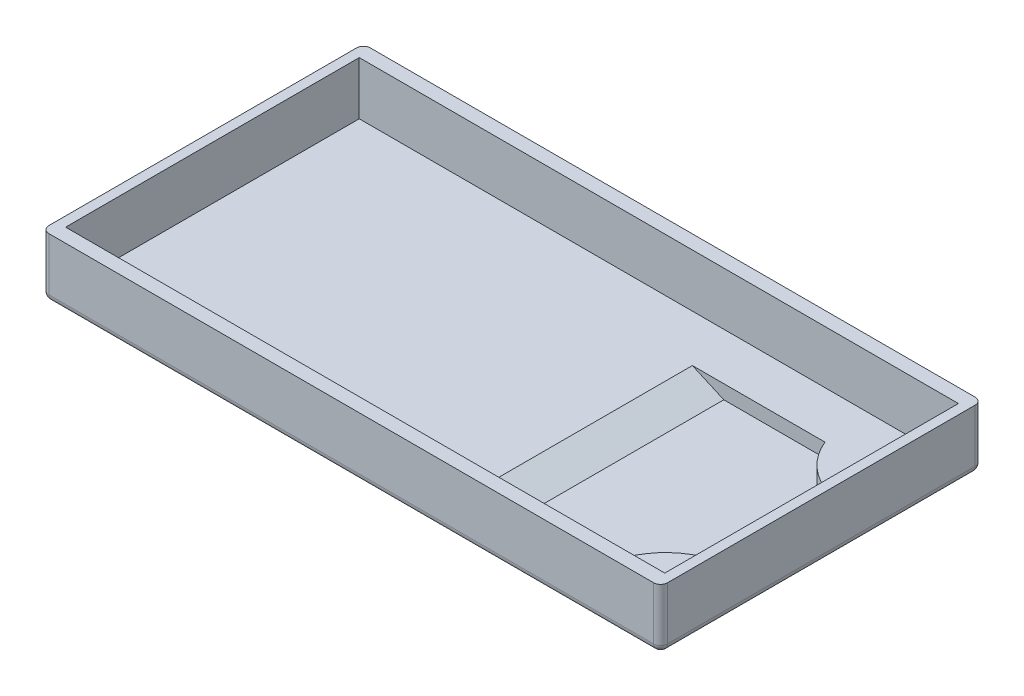
from build123d import *

# Parameters (mm, degrees)
BOTTOM_COVER_SKETCH_01_W                   = 44.37
BOTTOM_COVER_SKETCH_01_H                   = 23.06
BOTTOM_COVER_EXT_SHAPE_DEPTH               = 4.3
SALIENTE_EXTRUIR1_DEPTH                    = 1.4
CORTAR_EXTRUIR1_DEPTH                      = 30.966091253
CORTAR_EXTRUIR1_DEPTH_BACK                 = 30.966091253
VACIADO2_START                             = 0.5
VACIADO2_OUTLINE_W                         = 42.97
VACIADO2_OUTLINE_H                         = 21.06
VACIADO2_DEPTH                             = 3.8
SALIENTE_EXTRUIR2_DEPTH                    = 1.4
CORTAR_EXTRUIR2_DEPTH                      = 30.933277886
CORTAR_EXTRUIR2_DEPTH_BACK                 = 30.933277886
BOTTOM_POWER_TAKE_OFF_SHAFT_SKETCH_R       = 3
POWER_TAKE_OFF_SHAFT_EXTRUDE_01_DEPTH      = 3.9
BOTTOM_POWER_TAKE_OFF_SHAFT_SKETCH_3_R     = 4
BOTTOM_POWER_TAKE_OFF_SHAFT_SKETCH_3_R_2   = 3
POWER_TAKE_OFF_SHAFT_EXTRUDE_02_DEPTH      = 1
POWER_TAKE_OFF_SHAFT_CUT_DEPTH             = 1
POWER_TAKE_OFF_SHAFT_BOTTOM_COVER_SKETCH_R = 1
CORTAR_EXTRUIR4_DEPTH                      = 4.2
REDONDEO1_R                                = 0.5


with BuildPart() as part:
    # bottom-cover-sketch-01 → Bottom-cover-ext-shape (new body)
    with BuildSketch(Plane(origin=(0, 0, 0), x_dir=(1, 0, 0), z_dir=(0, 1, 0))):
        Rectangle(BOTTOM_COVER_SKETCH_01_W, BOTTOM_COVER_SKETCH_01_H)
    extrude(amount=BOTTOM_COVER_EXT_SHAPE_DEPTH)

    # bottom-cover-sketch-01<31> → Saliente-Extruir1 (add)
    with BuildSketch(Plane(origin=(0, 0, 0), x_dir=(1, 0, 0), z_dir=(0, 1, 0))):
        with BuildLine():
            Line((4.447, 8.15), (16.025784389, 8.15))
            ThreePointArc((16.025784389, 8.15), (17.087381076, 6.195438755), (19, 5.06001547))
            Line((19, 5.06001547), (19, -5.06001547))
            ThreePointArc((19, -5.06001547), (17.087381076, -6.195438755), (16.025784389, -8.15))
            Line((16.025784389, -8.15), (4.447, -8.15))
            Line((4.447, -8.15), (4.447, 8.15))
        make_face()
    extrude(amount=-SALIENTE_EXTRUIR1_DEPTH)

    # Croquis3 → Cortar-Extruir1 (cut, two sides: drawn at the far end of the back side and taken through both)
    with BuildSketch(Plane.XY.offset(8.15).offset(-CORTAR_EXTRUIR1_DEPTH_BACK)):
        Polygon((4.447, -1.4), (7.603, -1.4), (4.447, 0), align=None)
    extrude(amount=CORTAR_EXTRUIR1_DEPTH + CORTAR_EXTRUIR1_DEPTH_BACK, mode=Mode.SUBTRACT)

    # Vaciado2: read off the stored shape, not the designer's step
    # Vaciado2 outline → Vaciado2 (cut)
    with BuildSketch(Plane(origin=(0, 0, 0), x_dir=(1, 0, 0), z_dir=(0, 1, 0)).offset(VACIADO2_START)):
        Rectangle(VACIADO2_OUTLINE_W, VACIADO2_OUTLINE_H)
    extrude(amount=VACIADO2_DEPTH, mode=Mode.SUBTRACT)

    # Vaciado2 2: loft between two sections, ruled curve by curve
    vaciado2_2_from = [
        Edge.make_three_point_arc((15.297011486, -0.5, -7.15), (16.377210633, -0.5, -5.491282779), (18, -0.5, -4.357824492)),
        Edge.make_three_point_arc((18, -0.5, 4.357824492), (16.377210633, -0.5, 5.491282779), (15.297011486, -0.5, 7.15)),
        Edge.make_line((8.040274257, -0.5, -7.15), (15.297011486, -0.5, -7.15)),
        Edge.make_line((15.297011486, -0.5, 7.15), (8.040274257, -0.5, 7.15)),
        Edge.make_line((18, -0.5, -4.357824492), (18, -0.5, 4.357824492)),
        Edge.make_line((8.040274257, -0.5, 7.15), (8.040274257, -0.5, -7.15)),
    ]
    vaciado2_2_to = [
        Edge.make_three_point_arc((15.297011486, 0.5, -7.15), (16.377210633, 0.5, -5.491282779), (18, 0.5, -4.357824492)),
        Edge.make_three_point_arc((18, 0.5, 4.357824492), (16.377210633, 0.5, 5.491282779), (15.297011486, 0.5, 7.15)),
        Edge.make_line((5.785988543, 0.5, -7.15), (15.297011486, 0.5, -7.15)),
        Edge.make_line((15.297011486, 0.5, 7.15), (5.785988543, 0.5, 7.15)),
        Edge.make_line((18, 0.5, -4.357824492), (18, 0.5, 4.357824492)),
        Edge.make_line((5.785988543, 0.5, 7.15), (5.785988543, 0.5, -7.15)),
    ]
    vaciado2_2 = Solid(Shell([*[Face.make_surface_from_curves(vaciado2_2_from[k], vaciado2_2_to[k]) for k in range(6)], Face(Wire(vaciado2_2_from)), Face(Wire(vaciado2_2_to))]))
    add(vaciado2_2, mode=Mode.SUBTRACT)

    # bottom-cover-sketch-01<32> → Saliente-Extruir2 (add)
    with BuildSketch(Plane(origin=(0, 0, 0), x_dir=(1, 0, 0), z_dir=(0, 1, 0))):
        with BuildLine():
            Line((-1.8, -8.085967922), (-15.968544519, -8.085967922))
            ThreePointArc((-15.968544519, -8.085967922), (-17.060455349, -6.121867553), (-19, -4.986911136))
            Line((-19, -4.986911136), (-19, 5.04796656))
            ThreePointArc((-19, 5.04796656), (-17.09705221, 6.168745986), (-16.025784389, 8.1))
            Line((-16.025784389, 8.1), (-1.8, 8.1))
            Line((-1.8, 8.1), (-1.8, -8.085967922))
        make_face()
    extrude(amount=-SALIENTE_EXTRUIR2_DEPTH)

    # Croquis4 → Cortar-Extruir2 (cut, two sides: drawn at the far end of the back side and taken through both)
    with BuildSketch(Plane(origin=(0, 0, -8.1), x_dir=(-1, 0, 0), z_dir=(0, 0, -1)).offset(-CORTAR_EXTRUIR2_DEPTH_BACK)):
        Polygon((1.8, -1.4), (4.8, -1.4), (1.8, 0), align=None)
    extrude(amount=CORTAR_EXTRUIR2_DEPTH + CORTAR_EXTRUIR2_DEPTH_BACK, mode=Mode.SUBTRACT)

    # Bottom-power-take-off-shaft-sketch → Power-take-off-shaft-extrude-01 (add)
    with BuildSketch(Plane.XZ.offset(1.4)):
        with Locations(Location((-11.9, -0.018771875, 0), (0, 0, 270))):
            Circle(BOTTOM_POWER_TAKE_OFF_SHAFT_SKETCH_R)
    extrude(amount=POWER_TAKE_OFF_SHAFT_EXTRUDE_01_DEPTH)

    # Bottom-power-take-off-shaft-sketch<3> → Power-take-off-shaft-extrude-02 (add)
    with BuildSketch(Plane.XZ.offset(1.4)):
        with Locations(Location((-11.9, -0.018771875, 0), (0, 0, 90))):
            Circle(BOTTOM_POWER_TAKE_OFF_SHAFT_SKETCH_3_R)
        with Locations(Location((-11.9, -0.018771875, 0), (0, 0, 270))):
            Circle(BOTTOM_POWER_TAKE_OFF_SHAFT_SKETCH_3_R_2, mode=Mode.SUBTRACT)
    extrude(amount=POWER_TAKE_OFF_SHAFT_EXTRUDE_02_DEPTH)

    # Bottom-power-take-off-shaft-sketch<4> → Power-take-off-shaft-cut (cut)
    with BuildSketch(Plane.XZ.offset(1.4)):
        with BuildLine():
            Line((-13.454482392, -5.041059169), (-13.454482392, -6.345663941))
            ThreePointArc((-13.454482392, -6.345663941), (-13.609767702, -6.653654843), (-13.949729169, -6.711948276))
            ThreePointArc((-13.949729169, -6.711948276), (-16.710183373, -5.104254736), (-18.468864278, -2.437453767))
            ThreePointArc((-18.468864278, -2.437453767), (-18.423589426, -2.085954505), (-18.109382928, -1.922016039))
            Line((-18.109382928, -1.922016039), (-16.773422083, -1.922016039))
            ThreePointArc((-16.773422083, -1.922016039), (-16.567971503, -1.981769919), (-16.426615215, -2.142390177))
            ThreePointArc((-16.426615215, -2.142390177), (-15.30881206, -3.676640153), (-13.699675431, -4.68365862))
            ThreePointArc((-13.699675431, -4.68365862), (-13.521673241, -4.824348083), (-13.454482392, -5.041059169))
        make_face()
        with BuildLine():
            ThreePointArc((-18.070283639, 1.987983961), (-18.386311386, 2.15455721), (-18.427501404, 2.509414316))
            ThreePointArc((-18.427501404, 2.509414316), (-16.667494828, 5.106751812), (-13.949729169, 6.674404526))
            ThreePointArc((-13.949729169, 6.674404526), (-13.609767702, 6.616111093), (-13.454482392, 6.30812019))
            Line((-13.454482392, 6.30812019), (-13.454482392, 5.003515418))
            ThreePointArc((-13.454482392, 5.003515418), (-13.521673241, 4.786804333), (-13.699675431, 4.64611487))
            ThreePointArc((-13.699675431, 4.64611487), (-15.269573485, 3.675273946), (-16.380250969, 2.200991908))
            ThreePointArc((-16.380250969, 2.200991908), (-16.52151792, 2.045563265), (-16.723505638, 1.987983961))
            Line((-16.723505638, 1.987983961), (-18.070283639, 1.987983961))
        make_face()
        with BuildLine():
            ThreePointArc((-5.372498596, 2.509414316), (-6.810764187, 4.78744065), (-9.002861085, 6.353557848))
            ThreePointArc((-9.002861085, 6.353557848), (-9.368785516, 6.326920146), (-9.544482392, 6.00483186))
            Line((-9.544482392, 6.00483186), (-9.544482392, 4.615622196))
            ThreePointArc((-9.544482392, 4.615622196), (-9.494125288, 4.425766238), (-9.356293346, 4.285825255))
            ThreePointArc((-9.356293346, 4.285825255), (-8.236582512, 3.384075801), (-7.419749031, 2.200991908))
            ThreePointArc((-7.419749031, 2.200991908), (-7.27848208, 2.045563265), (-7.076494362, 1.987983961))
            Line((-7.076494362, 1.987983961), (-5.729716361, 1.987983961))
            ThreePointArc((-5.729716361, 1.987983961), (-5.413688614, 2.15455721), (-5.372498596, 2.509414316))
        make_face()
        with BuildLine():
            Line((-7.026577917, -1.922016039), (-5.690617072, -1.922016039))
            ThreePointArc((-5.690617072, -1.922016039), (-5.376410574, -2.085954505), (-5.331135722, -2.437453767))
            ThreePointArc((-5.331135722, -2.437453767), (-6.770756692, -4.782264616), (-9.002861085, -6.391101599))
            ThreePointArc((-9.002861085, -6.391101599), (-9.368785516, -6.364463896), (-9.544482392, -6.04237561))
            Line((-9.544482392, -6.04237561), (-9.544482392, -4.653165946))
            ThreePointArc((-9.544482392, -4.653165946), (-9.494125288, -4.463309988), (-9.356293346, -4.323369006))
            ThreePointArc((-9.356293346, -4.323369006), (-8.200468949, -3.382322083), (-7.373384785, -2.142390177))
            ThreePointArc((-7.373384785, -2.142390177), (-7.232028497, -1.981769919), (-7.026577917, -1.922016039))
        make_face()
    extrude(amount=-POWER_TAKE_OFF_SHAFT_CUT_DEPTH, mode=Mode.SUBTRACT)

    # Power-take-off-shaft-bottom-cover-sketch → Cortar-Extruir4 (cut)
    with BuildSketch(Plane.XZ.offset(5.3)):
        with Locations(Location((-11.9, -0.018771875, 0), (0, 0, 270))):
            Circle(POWER_TAKE_OFF_SHAFT_BOTTOM_COVER_SKETCH_R)
    extrude(amount=-CORTAR_EXTRUIR4_DEPTH, mode=Mode.SUBTRACT)

    # Redondeo1
    redondeo1_edges = [part.edges().sort_by_distance(p)[0] for p in [
        (0, 0, -11.53),
        (22.185, 0, 0),
        (0, 0, 11.53),
        (-22.185, 0, 0),
        (-22.185, 2.15, -11.53),
        (22.185, 2.15, -11.53),
        (22.185, 2.15, 11.53),
        (-22.185, 2.15, 11.53),
    ]]
    fillet(redondeo1_edges, radius=REDONDEO1_R)


solid = part.part
